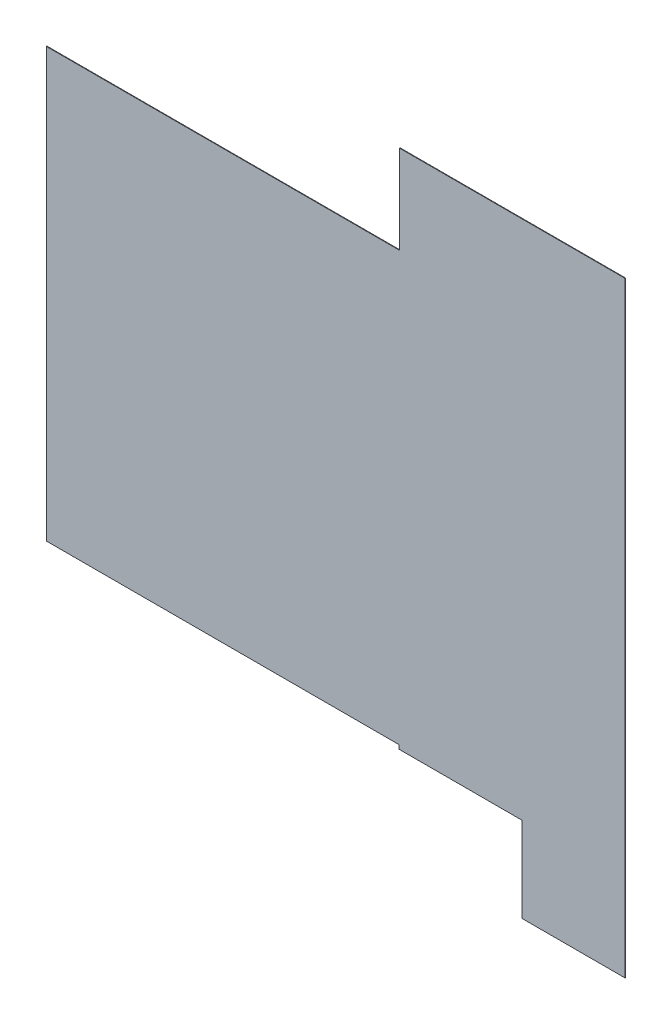
from build123d import *

# Parameters (mm, degrees)
BOSS_EXTRUDE1_DEPTH = 2


with BuildPart() as part:
    # Sketch1 → Boss-Extrude1 (new body)
    with BuildSketch(Plane.XY):
        Polygon((1242, 1506), (0, 1506), (0, 0), (1239.998813056, 0), (1239.998813056, -14), (1672.998813056, -14), (1672.998813056, -313), (2035, -313), (2035, 1817), (1242, 1817), align=None)
    extrude(amount=BOSS_EXTRUDE1_DEPTH)


solid = part.part
